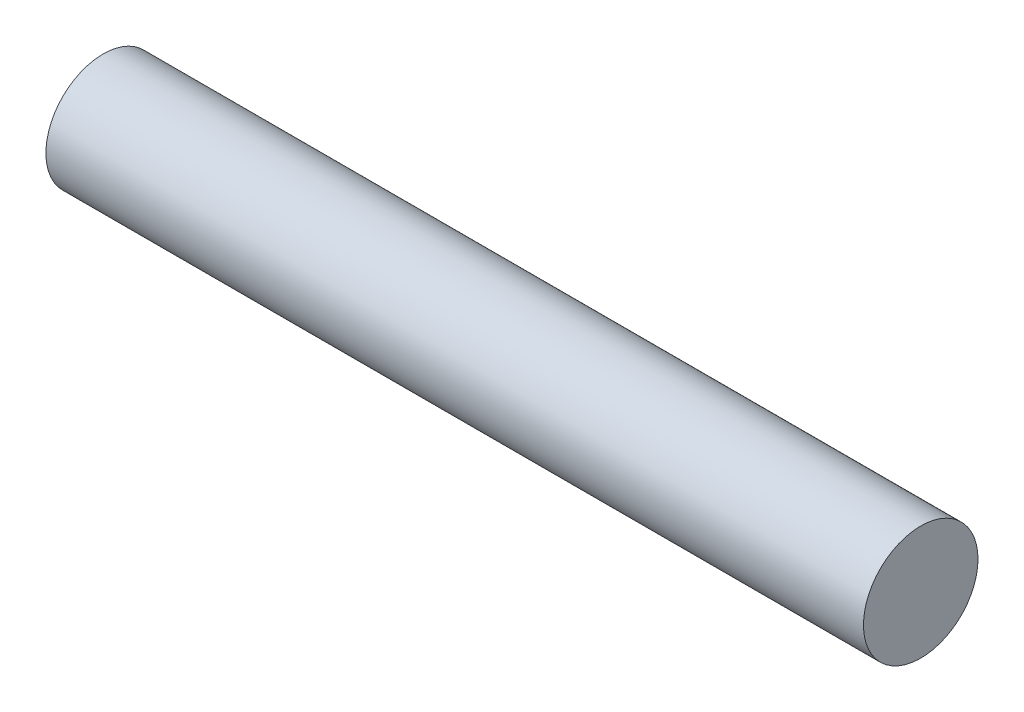
from build123d import *

# Parameters (mm, degrees)
SKETCH1_R           = 22.292818
BOSS_EXTRUDE1_DEPTH = 318.262


with BuildPart() as part:
    # Sketch1 → Boss-Extrude1 (new body)
    with BuildSketch(Plane(origin=(0, 0, 0), x_dir=(0, 0, -1), z_dir=(1, 0, 0))):
        Circle(SKETCH1_R)
    extrude(amount=-BOSS_EXTRUDE1_DEPTH)


solid = part.part
